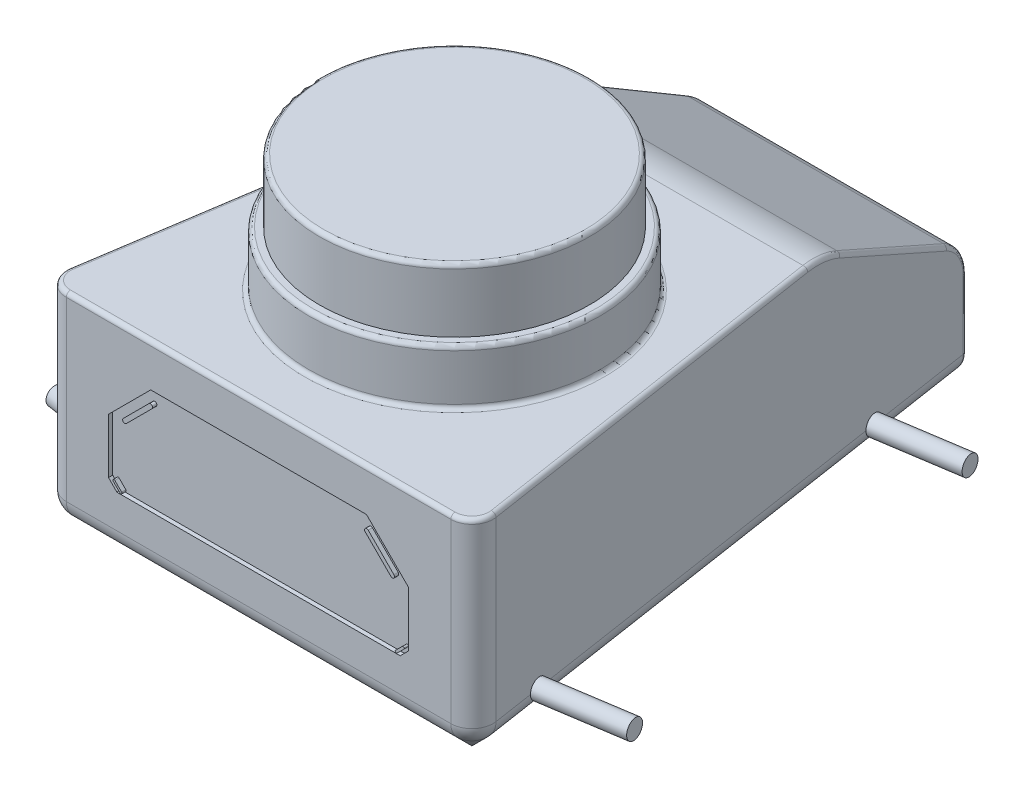
from build123d import *

# Parameters (mm, degrees)
BOSS_EXTRUDE1_DEPTH = 50
CUT_EXTRUDE5_DEPTH  = 55.5
FILLET2_R           = 20
FILLET3_R           = 10
FILLET4_R           = 5
CHAMFER2_SIZE       = 5
CUT_EXTRUDE6_DEPTH  = 1
FILLET5_R           = 5
FILLET6_R           = 1
SKETCH8_R           = 34.527500296
BOSS_EXTRUDE2_DEPTH = 13
FILLET7_R           = 1
FILLET8_R           = 1
SKETCH9_R           = 32
BOSS_EXTRUDE3_DEPTH = 15
FILLET9_R           = 1
SKETCH10_R          = 2.25
BOSS_EXTRUDE4_DEPTH = 20
SKETCH11_R          = 2.25
SKETCH11_R_2        = 2.25463414
BOSS_EXTRUDE5_DEPTH = 20


with BuildPart() as part:
    # Sketch1 → Boss-Extrude1 (new body)
    with BuildSketch(Plane(origin=(0, 0, 0), x_dir=(1, 0, 0), z_dir=(0, 1, 0))):
        Polygon((-51.398092619, 0), (51.398092619, 0), (30.341353011, 137.38084809), (-30.341353011, 137.38084809), align=None)
    extrude(amount=BOSS_EXTRUDE1_DEPTH)

    # Sketch6 → Cut-Extrude5 (cut, symmetric)
    with BuildSketch(Plane(origin=(0, 0, 0), x_dir=(0, 0, -1), z_dir=(1, 0, 0))):
        Polygon((92.469674373, 52.824174353), (139.292734298, 28.064336383), (139.292734298, 52.824174353), align=None)
    extrude(amount=CUT_EXTRUDE5_DEPTH, both=True, mode=Mode.SUBTRACT)

    # Fillet2
    fillet2_edges = [part.edges().sort_by_distance(p)[0] for p in [
        (0, 50, -97.810439735),
    ]]
    fillet(fillet2_edges, radius=FILLET2_R)

    # Fillet3
    fillet3_edges = [part.edges().sort_by_distance(p)[0] for p in [
        (0, 29.075333802, -137.38084809),
    ]]
    fillet(fillet3_edges, radius=FILLET3_R)

    # Fillet4
    fillet4_edges = [part.edges().sort_by_distance(p)[0] for p in [
        (51.398092619, 25, 0),
        (-51.398092619, 25, 0),
    ]]
    fillet(fillet4_edges, radius=FILLET4_R)

    # Chamfer2
    chamfer2_edges = [part.edges().sort_by_distance(p)[0] for p in [
        (0, 0, 0),
        (40.428487571, 0, -71.569182732),
        (49.367253823, 0, -1.743282855),
        (-49.367253823, 0, -1.743282855),
        (-40.428487571, 0, -71.569182732),
    ]]
    chamfer(chamfer2_edges, length=CHAMFER2_SIZE)

    # Sketch7 → Cut-Extrude6 (cut)
    with BuildSketch(Plane.XY):
        Polygon((-35.573338506, 17), (-33.573338506, 15), (33.573338506, 15), (35.573338506, 17), (35.573338506, 30), (25.573338506, 40), (-25.573338506, 40), (-35.573338506, 30), align=None)
        with BuildLine():
            Line((-25.266365334, 36.288148586), (-31.365780319, 30.1887336))
            ThreePointArc((-31.365780319, 30.1887336), (-32.0728871, 30.1887336), (-32.0728871, 30.895840382))
            Line((-32.0728871, 30.895840382), (-25.973472115, 36.995255367))
            ThreePointArc((-25.973472115, 36.995255367), (-25.266365334, 36.995255367), (-25.266365334, 36.288148586))
        make_face(mode=Mode.SUBTRACT)
        with BuildLine():
            Line((-34.078531496, 17.189532522), (-32.459493974, 15.570495001))
            ThreePointArc((-32.459493974, 15.570495001), (-32.459493974, 15.191429956), (-32.838559018, 15.191429956))
            Line((-32.838559018, 15.191429956), (-34.45759654, 16.810467478))
            ThreePointArc((-34.45759654, 16.810467478), (-34.45759654, 17.189532522), (-34.078531496, 17.189532522))
        make_face(mode=Mode.SUBTRACT)
        with BuildLine():
            Line((25.266365334, 36.288148586), (31.365780319, 30.1887336))
            ThreePointArc((31.365780319, 30.1887336), (32.0728871, 30.1887336), (32.0728871, 30.895840382))
            Line((32.0728871, 30.895840382), (25.973472115, 36.995255367))
            ThreePointArc((25.973472115, 36.995255367), (25.266365334, 36.995255367), (25.266365334, 36.288148586))
        make_face(mode=Mode.SUBTRACT)
        with BuildLine():
            Line((34.078531496, 17.189532522), (32.459493974, 15.570495001))
            ThreePointArc((32.459493974, 15.570495001), (32.459493974, 15.191429956), (32.838559018, 15.191429956))
            Line((32.838559018, 15.191429956), (34.45759654, 16.810467478))
            ThreePointArc((34.45759654, 16.810467478), (34.45759654, 17.189532522), (34.078531496, 17.189532522))
        make_face(mode=Mode.SUBTRACT)
    extrude(amount=-CUT_EXTRUDE6_DEPTH, mode=Mode.SUBTRACT)

    # Fillet5
    fillet5_edges = [part.edges().sort_by_distance(p)[0] for p in [
        (-40.428487571, 5, -71.569182732),
        (40.428487571, 5, -71.569182732),
        (-49.367253823, 5, -1.743282855),
        (49.367253823, 5, -1.743282855),
        (0, 5, 0),
    ]]
    fillet(fillet5_edges, radius=FILLET5_R)

    # Fillet6
    fillet6_edges = [part.edges().sort_by_distance(p)[0] for p in [
        (27.071373693, 1.767766953, -137.38084809),
        (29.955132562, 5.154852891, -137.38084809),
        (-29.955132562, 5.154852891, -137.38084809),
        (-43.841321308, 50, -49.302772931),
        (-33.44581189, 39.785815035, -117.126373678),
        (-36.429266086, 49.412153985, -97.661372195),
        (36.429266086, 49.412153985, -97.661372195),
        (-30.341353011, 15.061154294, -137.38084809),
        (30.341353011, 15.061154294, -137.38084809),
        (33.44581189, 39.785815035, -117.126373678),
        (30.562262133, 28.223119759, -135.939566906),
        (-30.562262133, 28.223119759, -135.939566906),
        (0, 50, 0),
        (43.841321308, 50, -49.302772931),
        (49.367253823, 50, -1.743282855),
        (-49.367253823, 50, -1.743282855),
        (-27.071373693, 1.767766953, -137.38084809),
    ]]
    fillet(fillet6_edges, radius=FILLET6_R)

    # Sketch8 → Boss-Extrude2 (add)
    with BuildSketch(Plane(origin=(0, 50, 0), x_dir=(1, 0, 0), z_dir=(0, 1, 0))):
        with Locations(Location((0, 46.424014243, 0), (0, 0, 90))):
            Circle(SKETCH8_R)
    extrude(amount=BOSS_EXTRUDE2_DEPTH)

    # Fillet7
    fillet7_edges = [part.edges().sort_by_distance(p)[0] for p in [
        (0, 63, -11.896513947),
    ]]
    fillet(fillet7_edges, radius=FILLET7_R)

    # Fillet8
    fillet8_edges = [part.edges().sort_by_distance(p)[0] for p in [
        (0, 50, -11.896513947),
    ]]
    fillet(fillet8_edges, radius=FILLET8_R)

    # Sketch9 → Boss-Extrude3 (add)
    with BuildSketch(Plane(origin=(0, 63, 0), x_dir=(1, 0, 0), z_dir=(0, 1, 0))):
        with Locations(Location((0, 46.424014243, 0), (0, 0, 270))):
            Circle(SKETCH9_R)
    extrude(amount=BOSS_EXTRUDE3_DEPTH)

    # Fillet9
    fillet9_edges = [part.edges().sort_by_distance(p)[0] for p in [
        (0, 78, -78.424014243),
    ]]
    fillet(fillet9_edges, radius=FILLET9_R)

    # Sketch10 → Boss-Extrude4 (add)
    with BuildSketch(Plane(origin=(50.21833663, 0, -7.697102272), x_dir=(-0.1515034749062424, 0, -0.9884567249461829), z_dir=(0.9884567249461829, 0, -0.1515034749062424))):
        with Locations((105.037764478, 7.071067812)):
            Circle(SKETCH10_R)
        with Locations((10.037764478, 7.071067812)):
            Circle(SKETCH10_R)
    extrude(amount=BOSS_EXTRUDE4_DEPTH)

    # Sketch11 → Boss-Extrude5 (add)
    with BuildSketch(Plane(origin=(-50.21833663, 0, -7.697102272), x_dir=(-0.1515034749062424, 0, 0.9884567249461829), z_dir=(-0.9884567249461829, 0, -0.1515034749062424))):
        with Locations((-105.037764478, 7.071067812)):
            Circle(SKETCH11_R)
        with Locations((-10.037764478, 7.071067812)):
            Circle(SKETCH11_R_2)
    extrude(amount=BOSS_EXTRUDE5_DEPTH)


solid = part.part
